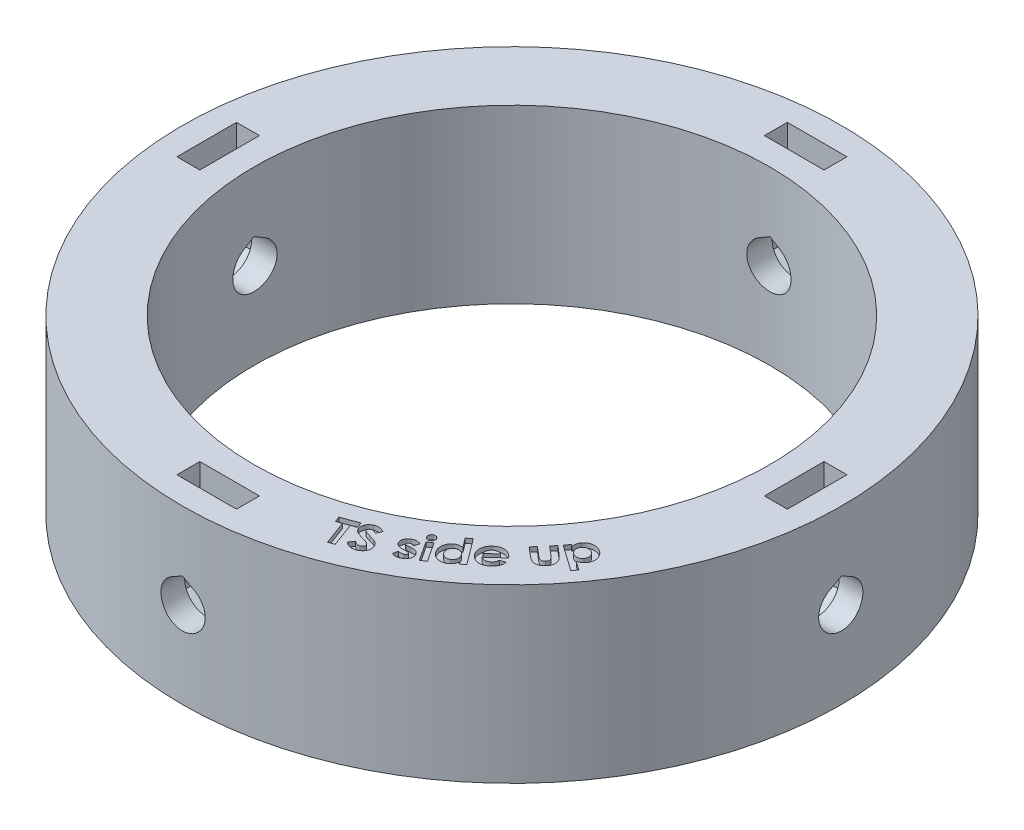
from build123d import *

# Parameters (mm, degrees)
SKETCH1_R           = 36.5125
SKETCH1_R_2         = 28.575
BOSS_EXTRUDE1_DEPTH = 19.05
CUT_EXTRUDE1_DEPTH  = 5.08
CUT_EXTRUDE2_DEPTH  = 1.27
CIRPATTERN1_COUNT   = 4
CUT_EXTRUDE3_DEPTH  = 0.5


with BuildPart() as part:
    # Sketch1 → Boss-Extrude1 (new body)
    with BuildSketch(Plane(origin=(0, 0, 0), x_dir=(1, 0, 0), z_dir=(0, 1, 0))):
        Circle(SKETCH1_R)
        Circle(SKETCH1_R_2, mode=Mode.SUBTRACT)
    extrude(amount=BOSS_EXTRUDE1_DEPTH)

    # Sketch3 → Cut-Extrude1 (cut, symmetric)
    with BuildSketch(Plane.XY.offset(-32.54375)):
        with BuildLine():
            Line((1.22555, 11.647714867), (0, 12.35528649))
            Line((0, 12.35528649), (-1.22555, 11.647714867))
            ThreePointArc((-1.22555, 11.647714867), (0, 7.0739), (1.22555, 11.647714867))
        make_face()
    cut_extrude1 = extrude(amount=CUT_EXTRUDE1_DEPTH, both=True, mode=Mode.SUBTRACT)

    # Sketch4 → Cut-Extrude2 (cut, symmetric)
    with BuildSketch(Plane.XY.offset(-32.54375)):
        Polygon((-3.302, 13.997732535), (-3.302, 26.091630277), (3.302, 26.091630277), (3.302, 14.365516556), (3.302, 7.618589411), (0, 5.712178822), (-3.302, 7.618589411), align=None)
    cut_extrude2 = extrude(amount=CUT_EXTRUDE2_DEPTH, both=True, mode=Mode.SUBTRACT)

    # CirPattern1: Cut-Extrude1, Cut-Extrude2 ×4 about axis
    cirpattern1_axis = Axis((0, -8.968103439, 0), (0, 1, 0))
    add([cut_extrude1.rotate(cirpattern1_axis, i * 360 / CIRPATTERN1_COUNT) for i in range(1, CIRPATTERN1_COUNT)], mode=Mode.SUBTRACT)
    add([cut_extrude2.rotate(cirpattern1_axis, i * 360 / CIRPATTERN1_COUNT) for i in range(1, CIRPATTERN1_COUNT)], mode=Mode.SUBTRACT)

    # Sketch8 → Cut-Extrude3 (cut)
    # profile 1 of 9: a face of its own
    with BuildSketch(Plane(origin=(0, 19.05, 0), x_dir=(1, 0, 0), z_dir=(0, 1, 0))):
        Polygon((9.730953632, -28.907476397), (11.530032158, -28.242111814), (11.756494497, -28.852788897), (11.163345459, -29.072240019), (12.141410363, -31.716871429), (11.512504113, -31.949643865), (10.534439209, -29.305012455), (9.957415972, -29.51815348), align=None)
    # profile 2 of 9: a face of its own
    with BuildSketch(Plane(origin=(0, 19.05, 0), x_dir=(1, 0, 0), z_dir=(0, 1, 0))):
        with BuildLine():
            Line((13.566608387, -27.843841245), (13.298779861, -28.436289162))
            add(Edge.make_bspline(
                [(13.298779861, -28.436289162), (13.267953168, -28.418964498), (13.20875252, -28.385693616), (13.119559328, -28.345776601), (13.035044399, -28.31555556), (12.954390805, -28.296368415), (12.877915964, -28.286693083), (12.80564399, -28.287852386), (12.737556969, -28.299498623), (12.695610369, -28.315475241), (12.674781464, -28.323408553)],
                knots=[0, 0, 0, 0, 1.289568868, 2.476532605, 3.560602779, 4.5595422, 5.495543601, 6.365438165, 7.1883458, 8, 8, 8, 8], degree=3))
            add(Edge.make_bspline(
                [(12.674781464, -28.323408553), (12.656161934, -28.332589463), (12.620306449, -28.350269072), (12.574416168, -28.38629893), (12.535651652, -28.426262918), (12.509528624, -28.47268123), (12.49042975, -28.519288897), (12.482737014, -28.565396194), (12.483851597, -28.609892049), (12.493826541, -28.636743561), (12.498799894, -28.650131309)],
                knots=[0, 0, 0, 0, 1.212126278, 2.334182229, 3.399141513, 4.448070807, 5.431410415, 6.333424315, 7.169071174, 8, 8, 8, 8], degree=3))
            add(Edge.make_bspline(
                [(12.498799894, -28.650131309), (12.505289568, -28.66309891), (12.51834332, -28.689182782), (12.547665294, -28.722260428), (12.580392583, -28.753828618), (12.607075637, -28.769154399), (12.620795086, -28.777034354)],
                knots=[0, 0, 0, 0, 0.967578232, 1.946249439, 2.944036637, 4, 4, 4, 4], degree=3))
            add(Edge.make_bspline(
                [(12.620795086, -28.777034354), (12.632427944, -28.782756936), (12.659291583, -28.795972035), (12.706565681, -28.815421072), (12.766208775, -28.836690898), (12.837917506, -28.861376108), (12.921907959, -28.888474511), (13.017985323, -28.918552871), (13.12604822, -28.951772844), (13.202453619, -28.973713285), (13.242690118, -28.985267527)],
                knots=[0, 0, 0, 0, 0.473883718, 1.094334745, 1.867397041, 2.788800434, 3.866912218, 5.093791661, 6.469536855, 8, 8, 8, 8], degree=3))
            add(Edge.make_bspline(
                [(13.242690118, -28.985267527), (13.280105289, -28.995707111), (13.351503266, -29.015628579), (13.452338206, -29.045054391), (13.542094877, -29.071181778), (13.620252774, -29.093991844), (13.687235548, -29.114628581), (13.742791483, -29.131643739), (13.786910063, -29.14656932), (13.812248587, -29.155835178), (13.823218964, -29.159846854)],
                knots=[0, 0, 0, 0, 1.537551974, 2.934053119, 4.157747224, 5.237873122, 6.15673285, 6.932090053, 7.537645724, 8, 8, 8, 8], degree=3))
            add(Edge.make_bspline(
                [(13.823218964, -29.159846854), (13.86532497, -29.177237787), (13.946088378, -29.210595285), (14.057783802, -29.268097003), (14.155644952, -29.328921232), (14.239857471, -29.39521197), (14.313548926, -29.467295753), (14.378357625, -29.546919705), (14.434931828, -29.635338601), (14.465840097, -29.698905647), (14.481572329, -29.731261117)],
                knots=[0, 0, 0, 0, 1.21847358, 2.337150645, 3.357250616, 4.296736933, 5.198789524, 6.109963901, 7.037976296, 8, 8, 8, 8], degree=3))
            add(Edge.make_bspline(
                [(14.481572329, -29.731261117), (14.495115382, -29.763261961), (14.521756954, -29.826213258), (14.549292731, -29.923503015), (14.568092231, -30.01986573), (14.575920663, -30.116052633), (14.572873958, -30.211686213), (14.560408938, -30.306931318), (14.536865819, -30.401599871), (14.503290384, -30.494734803), (14.460919589, -30.585263622), (14.408365385, -30.670397625), (14.348238575, -30.750608852), (14.278810972, -30.824771915), (14.200633472, -30.89287042), (14.11369647, -30.955141232), (14.019085999, -31.013494828), (13.950705765, -31.045590879), (13.915767041, -31.061990284)],
                knots=[0, 0, 0, 0, 1.027232463, 2.020747246, 2.984978895, 3.928457938, 4.869272605, 5.811027007, 6.765289594, 7.749520796, 8.736226468, 9.716978048, 10.704410326, 11.697564098, 12.716876414, 13.766691654, 14.8588962, 16, 16, 16, 16], degree=3))
            add(Edge.make_bspline(
                [(13.915767041, -31.061990284), (13.887842182, -31.073740279), (13.832801147, -31.096899997), (13.749195297, -31.126056355), (13.665637599, -31.147590863), (13.582498963, -31.163265045), (13.49975818, -31.172365728), (13.417256172, -31.175236445), (13.335217575, -31.17169614), (13.253350806, -31.161953938), (13.171725291, -31.145046904), (13.090155671, -31.12068912), (13.007608441, -31.090793453), (12.925294259, -31.052460453), (12.841861977, -31.008300327), (12.758943903, -30.95609588), (12.674953776, -30.897882392), (12.620562537, -30.85476899), (12.592750214, -30.832723457)],
                knots=[0, 0, 0, 0, 1.020228465, 2.010911841, 2.97882075, 3.92360299, 4.858000336, 5.779445279, 6.701192725, 7.620854235, 8.553227171, 9.504674393, 10.485806367, 11.507218269, 12.56008027, 13.66305977, 14.805032993, 16, 16, 16, 16], degree=3))
            Line((12.592750214, -30.832723457), (12.959436913, -30.301273136))
            add(Edge.make_bspline(
                [(12.959436913, -30.301273136), (12.993170003, -30.325920026), (13.057630327, -30.373017593), (13.156324285, -30.43161739), (13.251094948, -30.476844564), (13.343116445, -30.506584964), (13.431254417, -30.523506863), (13.516077971, -30.526061528), (13.59729079, -30.513768), (13.647506598, -30.494532449), (13.672477778, -30.484967046)],
                knots=[0, 0, 0, 0, 1.296238337, 2.476972667, 3.557752419, 4.548862222, 5.470922787, 6.334506283, 7.171787833, 8, 8, 8, 8], degree=3))
            add(Edge.make_bspline(
                [(13.672477778, -30.484967046), (13.696775504, -30.472650624), (13.743837613, -30.448795024), (13.805484689, -30.400914703), (13.855408957, -30.343970201), (13.892642067, -30.279673956), (13.918366194, -30.212895209), (13.928359053, -30.146246715), (13.925176911, -30.081578477), (13.91051573, -30.042079373), (13.903146849, -30.022226662)],
                knots=[0, 0, 0, 0, 1.141901761, 2.211742185, 3.254920696, 4.301785362, 5.317128285, 6.240057363, 7.115432263, 8, 8, 8, 8], degree=3))
            add(Edge.make_bspline(
                [(13.903146849, -30.022226662), (13.893900991, -30.004802902), (13.875138839, -29.969445747), (13.835319296, -29.921802647), (13.785714239, -29.879032416), (13.736310411, -29.847448728), (13.689250512, -29.823883875), (13.64616754, -29.804224217), (13.595086917, -29.784930204), (13.536696922, -29.763781172), (13.47068256, -29.741341355), (13.39674805, -29.719423783), (13.315874675, -29.695034888), (13.259092624, -29.679695504), (13.229368804, -29.671665764)],
                knots=[0, 0, 0, 0, 0.905539591, 1.837565657, 2.835889137, 3.909590732, 4.525094454, 5.256552023, 6.087180603, 7.03610872, 8.113947701, 9.294181276, 10.583579318, 12, 12, 12, 12], degree=3))
            add(Edge.make_bspline(
                [(13.229368804, -29.671665764), (13.172999458, -29.656170775), (13.064718071, -29.626406035), (12.90963149, -29.580971506), (12.768791358, -29.536404933), (12.642100467, -29.49212261), (12.529552209, -29.449039763), (12.430764385, -29.406907364), (12.345839449, -29.366280098), (12.273923597, -29.324583824), (12.211617065, -29.282306329), (12.155347723, -29.238562222), (12.103311624, -29.193430165), (12.056810297, -29.145230634), (12.014913841, -29.095389997), (11.976316354, -29.044352251), (11.944155744, -28.989923643), (11.925955943, -28.952213263), (11.916868804, -28.933384514)],
                knots=[0, 0, 0, 0, 1.803057786, 3.463541974, 4.984061263, 6.358711616, 7.602308174, 8.700227831, 9.670580559, 10.503867933, 11.261586112, 11.99114668, 12.701108216, 13.384177469, 14.054229565, 14.708748023, 15.355279378, 16, 16, 16, 16], degree=3))
            add(Edge.make_bspline(
                [(11.916868804, -28.933384514), (11.905515421, -28.906019855), (11.883178131, -28.852181072), (11.860403994, -28.768563518), (11.844939442, -28.684627883), (11.840392855, -28.599886963), (11.844619073, -28.514589032), (11.85814073, -28.42885492), (11.880637434, -28.342411695), (11.912421042, -28.256751096), (11.950895176, -28.172965307), (11.998129692, -28.094559634), (12.051900888, -28.021357952), (12.112846677, -27.954277778), (12.180719614, -27.892763908), (12.255483511, -27.837323694), (12.337032041, -27.787083939), (12.395456305, -27.759180248), (12.425182105, -27.744983072)],
                knots=[0, 0, 0, 0, 0.987500942, 1.942865397, 2.885061945, 3.830093336, 4.766918987, 5.729636897, 6.720610151, 7.74182716, 8.774352229, 9.79196116, 10.790025548, 11.800199137, 12.810372725, 13.841159362, 14.901599079, 16, 16, 16, 16], degree=3))
            add(Edge.make_bspline(
                [(12.425182105, -27.744983072), (12.464805461, -27.728808984), (12.543512747, -27.696681001), (12.667540802, -27.665964885), (12.794668129, -27.650597602), (12.903041865, -27.650148165), (12.99270784, -27.657276102), (13.064037335, -27.668958599), (13.139265015, -27.684920407), (13.217730792, -27.707068411), (13.299837149, -27.733705685), (13.385529423, -27.765627012), (13.475354764, -27.801725116), (13.53564238, -27.829549557), (13.566608387, -27.843841245)],
                knots=[0, 0, 0, 0, 1.297366174, 2.577070194, 3.863105782, 5.1751206, 5.858299831, 6.590515924, 7.366678719, 8.190831942, 9.063247061, 9.985435406, 10.965243179, 12, 12, 12, 12], degree=3))
        make_face()
    # profile 3 of 9: a face of its own
    with BuildSketch(Plane(origin=(0, 19.05, 0), x_dir=(1, 0, 0), z_dir=(0, 1, 0))):
        with BuildLine():
            Line((16.781191217, -26.958667441), (16.638162371, -27.505542441))
            add(Edge.make_bspline(
                [(16.638162371, -27.505542441), (16.611354883, -27.499133446), (16.559652719, -27.486772762), (16.48399234, -27.474301053), (16.413517132, -27.466672032), (16.347808558, -27.46604958), (16.286945904, -27.470600137), (16.231204798, -27.481063271), (16.180151766, -27.496846206), (16.149738108, -27.513006747), (16.134756922, -27.520967121)],
                knots=[0, 0, 0, 0, 1.282121409, 2.472758748, 3.565624503, 4.577004091, 5.526136088, 6.400563937, 7.212148408, 8, 8, 8, 8], degree=3))
            add(Edge.make_bspline(
                [(16.134756922, -27.520967121), (16.120200209, -27.529894209), (16.092352348, -27.546972262), (16.057308847, -27.577954075), (16.029499464, -27.610745835), (16.01072932, -27.645497281), (15.999806006, -27.680563021), (15.996537287, -27.714617226), (16.002235545, -27.747581884), (16.01201162, -27.767020474), (16.016968461, -27.776876576)],
                knots=[0, 0, 0, 0, 1.30211121, 2.491016384, 3.556082204, 4.570426685, 5.485169084, 6.344965124, 7.160834569, 8, 8, 8, 8], degree=3))
            add(Edge.make_bspline(
                [(16.016968461, -27.776876576), (16.027329, -27.790419171), (16.048849839, -27.818549757), (16.092551954, -27.840241598), (16.138635616, -27.848380076), (16.188472125, -27.851346686), (16.252369125, -27.850107097), (16.299530381, -27.84719031), (16.32546205, -27.845586512)],
                knots=[0, 0, 0, 0, 0.913761353, 1.898058716, 2.542946586, 3.443128177, 4.594101208, 6, 6, 6, 6], degree=3))
            Line((16.32546205, -27.845586512), (16.589083845, -27.827357345))
            add(Edge.make_bspline(
                [(16.589083845, -27.827357345), (16.622725188, -27.825177698), (16.687860188, -27.820957553), (16.782598447, -27.81989231), (16.871050628, -27.821484776), (16.95316273, -27.827977032), (17.02933889, -27.837407273), (17.099120451, -27.851393283), (17.163054812, -27.868712744), (17.239030051, -27.897630242), (17.326486067, -27.943475915), (17.418948832, -28.016553913), (17.502041749, -28.10425836), (17.546021072, -28.172901613), (17.568550993, -28.20806648)],
                knots=[0, 0, 0, 0, 1.084942734, 2.100621962, 3.048753861, 3.931512788, 4.750764755, 5.51793512, 6.220615562, 6.88008866, 8.13196131, 9.380937463, 10.658295171, 12, 12, 12, 12], degree=3))
            add(Edge.make_bspline(
                [(17.568550993, -28.20806648), (17.582158104, -28.232581577), (17.609001826, -28.280944264), (17.639651722, -28.356725005), (17.661761986, -28.433331223), (17.675166695, -28.510926896), (17.679982205, -28.589665843), (17.676667584, -28.669406799), (17.66355666, -28.749677795), (17.642769956, -28.830093938), (17.613074452, -28.909088591), (17.576385187, -28.986065188), (17.529288035, -29.058307049), (17.474953946, -29.127627594), (17.412299808, -29.193326716), (17.341975701, -29.256351429), (17.262202445, -29.314255695), (17.205134357, -29.349619949), (17.175922788, -29.367721928)],
                knots=[0, 0, 0, 0, 0.978962257, 1.931268867, 2.848804707, 3.760361627, 4.676733912, 5.600390469, 6.542842938, 7.513356419, 8.497786738, 9.487520174, 10.486474668, 11.504210383, 12.561284597, 13.654456509, 14.799381432, 16, 16, 16, 16], degree=3))
            add(Edge.make_bspline(
                [(17.175922788, -29.367721928), (17.13566546, -29.389578053), (17.056941997, -29.432317845), (16.933936547, -29.481437411), (16.809717655, -29.513511691), (16.684602874, -29.531905437), (16.558572733, -29.532671703), (16.43168238, -29.519481525), (16.304154977, -29.489815971), (16.221166169, -29.459084427), (16.178927595, -29.443443082)],
                knots=[0, 0, 0, 0, 1.058071475, 2.06906555, 3.051597455, 4.01708743, 4.983951211, 5.956185788, 6.959765787, 8, 8, 8, 8], degree=3))
            Line((16.178927595, -29.443443082), (16.301623909, -28.869925454))
            add(Edge.make_bspline(
                [(16.301623909, -28.869925454), (16.329281438, -28.878691582), (16.384182654, -28.896092671), (16.468908858, -28.911732333), (16.554044598, -28.92031544), (16.638541132, -28.921043327), (16.719057034, -28.914258282), (16.792334778, -28.901125658), (16.857508456, -28.88237501), (16.895494125, -28.862585153), (16.913703236, -28.853098531)],
                knots=[0, 0, 0, 0, 1.107694917, 2.198815272, 3.28466059, 4.374171838, 5.422805234, 6.366909422, 7.217148777, 8, 8, 8, 8], degree=3))
            add(Edge.make_bspline(
                [(16.913703236, -28.853098531), (16.930885894, -28.842138184), (16.963848324, -28.821112352), (17.005640972, -28.783040551), (17.0380211, -28.741482916), (17.061407026, -28.697606358), (17.074418369, -28.652919475), (17.079730611, -28.610206661), (17.07319712, -28.569728692), (17.06177781, -28.54601979), (17.056030961, -28.534088114)],
                knots=[0, 0, 0, 0, 1.264821735, 2.426376532, 3.492495375, 4.525354141, 5.494910021, 6.370626384, 7.180005983, 8, 8, 8, 8], degree=3))
            add(Edge.make_bspline(
                [(17.056030961, -28.534088114), (17.048984269, -28.523896625), (17.034453311, -28.502880793), (17.003130183, -28.477526616), (16.964559016, -28.457497855), (16.919080751, -28.441232857), (16.866227891, -28.430432489), (16.806114863, -28.424578384), (16.738633051, -28.422310109), (16.691207456, -28.424801848), (16.666207243, -28.426115358)],
                knots=[0, 0, 0, 0, 0.699974392, 1.44341468, 2.255976412, 3.157530186, 4.174156525, 5.307275732, 6.580541183, 8, 8, 8, 8], degree=3))
            Line((16.666207243, -28.426115358), (16.424320223, -28.442241159))
            add(Edge.make_bspline(
                [(16.424320223, -28.442241159), (16.36847132, -28.444666474), (16.261591877, -28.449307861), (16.107859182, -28.43982279), (15.968274542, -28.415578463), (15.842790793, -28.377281467), (15.730696212, -28.325628528), (15.633843052, -28.257854604), (15.550812162, -28.175908366), (15.508286626, -28.1114474), (15.486920384, -28.079060069)],
                knots=[0, 0, 0, 0, 1.264049976, 2.419044032, 3.476942588, 4.46197514, 5.379658928, 6.256784226, 7.124150475, 8, 8, 8, 8], degree=3))
            add(Edge.make_bspline(
                [(15.486920384, -28.079060069), (15.475076619, -28.057053891), (15.451751739, -28.01371535), (15.423843227, -27.945858666), (15.405105902, -27.876294173), (15.393967129, -27.805542542), (15.389321783, -27.733643507), (15.393976784, -27.660310267), (15.405975006, -27.585646653), (15.425680161, -27.510619144), (15.451767522, -27.436287752), (15.48669907, -27.365539887), (15.527129325, -27.297753059), (15.575441861, -27.234391796), (15.630117439, -27.174500929), (15.692423227, -27.119349064), (15.760655328, -27.066621865), (15.810528712, -27.036035613), (15.836079038, -27.020366159)],
                knots=[0, 0, 0, 0, 0.964468801, 1.899406238, 2.825287424, 3.739043083, 4.660959021, 5.600890006, 6.569528091, 7.576206753, 8.592223112, 9.605109678, 10.617111733, 11.634889369, 12.67580082, 13.742820204, 14.84363813, 16, 16, 16, 16], degree=3))
            add(Edge.make_bspline(
                [(15.836079038, -27.020366159), (15.872357555, -27.000788065), (15.944275677, -26.961976675), (16.058926009, -26.919548344), (16.176844131, -26.889443704), (16.298107018, -26.874410212), (16.420729736, -26.872602877), (16.542733707, -26.886537018), (16.664140408, -26.913180367), (16.741794604, -26.943357537), (16.781191217, -26.958667441)],
                knots=[0, 0, 0, 0, 1.006208345, 1.994695994, 2.978024038, 3.973873601, 4.973253281, 5.967087036, 6.968634164, 8, 8, 8, 8], degree=3))
        make_face()
    # profile 4 of 9: a face of its own
    with BuildSketch(Plane(origin=(0, 19.05, 0), x_dir=(1, 0, 0), z_dir=(0, 1, 0))):
        with BuildLine():
            add(Edge.make_bspline(
                [(16.622449765, -25.390707394), (16.646270252, -25.376823256), (16.692897494, -25.349645851), (16.770779977, -25.326767194), (16.851711329, -25.32161132), (16.933588762, -25.331650603), (17.013031041, -25.355242434), (17.084807173, -25.395057991), (17.148210665, -25.448258875), (17.180735351, -25.49321568), (17.197369637, -25.516208195)],
                knots=[0, 0, 0, 0, 1.0093759, 1.975795618, 2.947721828, 3.967220221, 4.990358339, 5.969528258, 6.961544217, 8, 8, 8, 8], degree=3))
            add(Edge.make_bspline(
                [(17.197369637, -25.516208195), (17.211570195, -25.540238079), (17.23921248, -25.587013766), (17.261609498, -25.665548931), (17.26896006, -25.746298627), (17.258986914, -25.827897135), (17.237129702, -25.906686587), (17.198964757, -25.977206632), (17.148368855, -26.038948798), (17.105599018, -26.070255101), (17.083787906, -26.086220214)],
                knots=[0, 0, 0, 0, 1.034983688, 2.014661176, 3.009965468, 4.033816618, 5.057667767, 6.034329309, 6.997577105, 8, 8, 8, 8], degree=3))
            add(Edge.make_bspline(
                [(17.083787906, -26.086220214), (17.059765553, -26.100438474), (17.012617136, -26.128344501), (16.933485683, -26.150449945), (16.85175316, -26.157134856), (16.769140258, -26.146162474), (16.689612488, -26.120660408), (16.617217093, -26.080495075), (16.553121278, -26.026738679), (16.520564816, -25.981160812), (16.503960182, -25.957914926)],
                knots=[0, 0, 0, 0, 1.010557539, 1.98341048, 2.954519855, 3.973073982, 4.99088442, 5.971600194, 6.965463858, 8, 8, 8, 8], degree=3))
            add(Edge.make_bspline(
                [(16.503960182, -25.957914926), (16.490043763, -25.934339629), (16.4627024, -25.888021627), (16.440299747, -25.810451098), (16.434147703, -25.730408831), (16.443162452, -25.649399602), (16.467831549, -25.571653543), (16.504664492, -25.499977842), (16.557532177, -25.43892628), (16.600521272, -25.406995237), (16.622449765, -25.390707394)],
                knots=[0, 0, 0, 0, 1.017870471, 1.999793523, 2.979275759, 3.996810219, 5.019707609, 6.00630164, 6.983025805, 8, 8, 8, 8], degree=3))
        make_face()
    # profile 5 of 9: a face of its own
    with BuildSketch(Plane(origin=(0, 19.05, 0), x_dir=(1, 0, 0), z_dir=(0, 1, 0))):
        Polygon((16.930242233, -26.450803548), (17.470106015, -26.097438163), (18.87445297, -28.242870855), (18.334589188, -28.59623624), align=None)
    # profile 6 of 9: a face of its own
    with BuildSketch(Plane(origin=(0, 19.05, 0), x_dir=(1, 0, 0), z_dir=(0, 1, 0))):
        with BuildLine():
            Line((18.738323734, -23.921509229), (19.250843766, -23.537294485))
            Line((19.250843766, -23.537294485), (21.385058509, -26.37894112))
            Line((21.385058509, -26.37894112), (20.872538477, -26.763155863))
            Line((20.872538477, -26.763155863), (20.709878221, -26.546509229))
            add(Edge.make_bspline(
                [(20.709878221, -26.546509229), (20.70223054, -26.587818492), (20.687389947, -26.667980559), (20.653249183, -26.781578883), (20.612694205, -26.885726944), (20.564174671, -26.980650751), (20.506408527, -27.067381026), (20.439832693, -27.14760203), (20.364916905, -27.223288641), (20.308625609, -27.267823798), (20.280090561, -27.290399453)],
                knots=[0, 0, 0, 0, 1.142010487, 2.216111178, 3.220709643, 4.178857738, 5.109794492, 6.049093607, 7.011051201, 8, 8, 8, 8], degree=3))
            add(Edge.make_bspline(
                [(20.280090561, -27.290399453), (20.246692961, -27.314078425), (20.180854099, -27.360758325), (20.074604039, -27.416646881), (19.965284906, -27.4614543), (19.851690595, -27.493716588), (19.734214772, -27.514282891), (19.612703693, -27.521583487), (19.48752913, -27.517503751), (19.360231158, -27.500176192), (19.233444023, -27.473041505), (19.110995458, -27.432617258), (18.993798083, -27.381451421), (18.882700755, -27.317816835), (18.777027106, -27.243174381), (18.677051127, -27.156801657), (18.58191363, -27.059640284), (18.525216427, -26.987151141), (18.496436714, -26.950355382)],
                knots=[0, 0, 0, 0, 0.971843244, 1.91585789, 2.844957526, 3.774770457, 4.716004494, 5.673076446, 6.662076694, 7.686982627, 8.721754666, 9.73850472, 10.745503012, 11.755238236, 12.775182888, 13.814771302, 14.89076976, 16, 16, 16, 16], degree=3))
            add(Edge.make_bspline(
                [(18.496436714, -26.950355382), (18.468174159, -26.911078422), (18.412739224, -26.834039539), (18.342688064, -26.712781351), (18.284661885, -26.590796601), (18.240193842, -26.467234511), (18.208351235, -26.342575329), (18.189384336, -26.216446951), (18.182814431, -26.089124366), (18.190175702, -25.961848347), (18.208943696, -25.837505479), (18.238033305, -25.718222993), (18.279175693, -25.60606022), (18.330462416, -25.50011673), (18.393051236, -25.400692596), (18.467536571, -25.308683326), (18.551542245, -25.222267293), (18.615037621, -25.171876145), (18.6471779, -25.146369004)],
                knots=[0, 0, 0, 0, 1.148151085, 2.252014308, 3.319240039, 4.351183292, 5.364463099, 6.3688329, 7.374305462, 8.385608669, 9.389978471, 10.356153547, 11.29518435, 12.220743601, 13.145853749, 14.077330778, 15.026777555, 16, 16, 16, 16], degree=3))
            add(Edge.make_bspline(
                [(18.6471779, -25.146369004), (18.678068078, -25.124435725), (18.739337355, -25.080932054), (18.837836217, -25.027980183), (18.939731095, -24.985401378), (19.045403131, -24.953524075), (19.155019032, -24.933569787), (19.268141078, -24.923561924), (19.384651628, -24.924907649), (19.462873893, -24.934149627), (19.50254649, -24.938836953)],
                knots=[0, 0, 0, 0, 1.00449744, 1.992375475, 2.959798334, 3.930970562, 4.914967476, 5.910987181, 6.940499039, 8, 8, 8, 8], degree=3))
            Line((19.50254649, -24.938836953), (18.738323734, -23.921509229))
        make_face()
        with BuildLine():
            add(Edge.make_bspline(
                [(19.108516041, -25.541801696), (19.089196969, -25.556782888), (19.05118114, -25.586262689), (19.001700939, -25.637415069), (18.957861068, -25.690754082), (18.920141346, -25.747409645), (18.889160328, -25.807798194), (18.865507138, -25.87195023), (18.847823525, -25.939089664), (18.836678153, -26.008830139), (18.832504384, -26.079999944), (18.83536504, -26.151141182), (18.844900119, -26.221506397), (18.863035156, -26.290865864), (18.88755007, -26.359665524), (18.919236223, -26.427712709), (18.958109839, -26.495122615), (18.988934226, -26.537887938), (19.004750016, -26.559830543)],
                knots=[0, 0, 0, 0, 1.022658212, 2.012374035, 2.972363332, 3.91162174, 4.857131944, 5.807946524, 6.769431521, 7.760646511, 8.760713529, 9.750042101, 10.738353418, 11.728262809, 12.746790948, 13.793384246, 14.867800026, 16, 16, 16, 16], degree=3))
            add(Edge.make_bspline(
                [(19.004750016, -26.559830543), (19.021430777, -26.581189721), (19.054094526, -26.623014601), (19.108706803, -26.679170556), (19.165320253, -26.729380299), (19.225435678, -26.772240599), (19.28802973, -26.809259647), (19.354009233, -26.8385343), (19.422643265, -26.861067008), (19.493051087, -26.877195765), (19.564202206, -26.88614622), (19.634702304, -26.888722532), (19.703454276, -26.882578796), (19.77066011, -26.871264301), (19.835446236, -26.850843533), (19.899143641, -26.825066023), (19.960987096, -26.791364798), (19.999675469, -26.763798428), (20.019273253, -26.749834549)],
                knots=[0, 0, 0, 0, 1.126902004, 2.206664504, 3.254108338, 4.271509047, 5.273880717, 6.275072431, 7.268346088, 8.275658477, 9.275574275, 10.248455134, 11.204619677, 12.143115688, 13.078280645, 14.024553479, 14.999327907, 16, 16, 16, 16], degree=3))
            add(Edge.make_bspline(
                [(20.019273253, -26.749834549), (20.038717491, -26.734269149), (20.076876936, -26.703721949), (20.128416995, -26.653066716), (20.172919267, -26.598650214), (20.210754159, -26.540972652), (20.242880179, -26.48039967), (20.267232012, -26.415996104), (20.285805068, -26.34844029), (20.296439173, -26.277848849), (20.301786213, -26.206072615), (20.298938572, -26.134106326), (20.288143228, -26.062998798), (20.270607486, -25.992224372), (20.245053671, -25.922177973), (20.212706315, -25.852377341), (20.17245249, -25.783204928), (20.140713931, -25.739029722), (20.124441522, -25.716381023)],
                knots=[0, 0, 0, 0, 1.025770081, 2.013080445, 2.971077312, 3.916506227, 4.851134396, 5.789969389, 6.747675851, 7.732353133, 8.726448894, 9.70938259, 10.692599239, 11.685154815, 12.708572001, 13.759744121, 14.851417243, 16, 16, 16, 16], degree=3))
            add(Edge.make_bspline(
                [(20.124441522, -25.716381023), (20.107526088, -25.694788934), (20.074597192, -25.6527561), (20.019794401, -25.596327625), (19.96315442, -25.546155223), (19.903365758, -25.50337079), (19.841288587, -25.467136596), (19.776396946, -25.43825207), (19.708706607, -25.416390246), (19.638876082, -25.401877649), (19.568655682, -25.394156224), (19.498914421, -25.393463542), (19.43041664, -25.399393262), (19.363097606, -25.413982427), (19.297165267, -25.434720483), (19.232735762, -25.46369184), (19.168657542, -25.498003065), (19.128767673, -25.527053249), (19.108516041, -25.541801696)],
                knots=[0, 0, 0, 0, 1.137197933, 2.213757636, 3.258094537, 4.272477426, 5.258619391, 6.235182286, 7.213284136, 8.203991157, 9.18903627, 10.139253449, 11.093419599, 12.03469102, 12.991366131, 13.955138881, 14.961847336, 16, 16, 16, 16], degree=3))
        make_face(mode=Mode.SUBTRACT)
    # profile 7 of 9: a face of its own
    with BuildSketch(Plane(origin=(0, 19.05, 0), x_dir=(1, 0, 0), z_dir=(0, 1, 0))):
        with BuildLine():
            Line((23.057973735, -23.41821344), (21.521114761, -24.811342446))
            add(Edge.make_bspline(
                [(21.521114761, -24.811342446), (21.539089548, -24.825259572), (21.574412752, -24.85260885), (21.631051173, -24.886875969), (21.688503297, -24.91571475), (21.746906708, -24.93896626), (21.806450564, -24.956853026), (21.867295347, -24.9685335), (21.929236604, -24.975181362), (21.991921754, -24.974795293), (22.05465403, -24.969568334), (22.117099556, -24.957335659), (22.178535566, -24.93908914), (22.23905307, -24.915131758), (22.298463702, -24.88544025), (22.356772959, -24.849415184), (22.414313194, -24.807283453), (22.451014475, -24.775612157), (22.469732549, -24.759459433)],
                knots=[0, 0, 0, 0, 1.044695683, 2.052986632, 3.038332538, 3.998322903, 4.940274833, 5.89301806, 6.84375864, 7.80031346, 8.771430011, 9.734723759, 10.720948523, 11.714873728, 12.724252462, 13.771267608, 14.863320959, 16, 16, 16, 16], degree=3))
            add(Edge.make_bspline(
                [(22.469732549, -24.759459433), (22.491209599, -24.739084062), (22.533651533, -24.698819214), (22.588906718, -24.63170864), (22.637013663, -24.561069425), (22.677817486, -24.48703299), (22.710152038, -24.408828333), (22.735699779, -24.327540547), (22.752503824, -24.241896093), (22.757934864, -24.183434542), (22.760698094, -24.153690202)],
                knots=[0, 0, 0, 0, 1.029366084, 2.034184702, 3.017647947, 4.000303861, 4.969951071, 5.957708935, 6.960913651, 8, 8, 8, 8], degree=3))
            Line((22.760698094, -24.153690202), (23.334916844, -23.977708632))
            add(Edge.make_bspline(
                [(23.334916844, -23.977708632), (23.338035455, -24.006660042), (23.344185662, -24.063755054), (23.347874927, -24.149003693), (23.345294098, -24.23231104), (23.339614119, -24.313891181), (23.327233384, -24.393439882), (23.310754031, -24.471582787), (23.28789603, -24.547690513), (23.261520855, -24.622684761), (23.228893028, -24.69554252), (23.191679015, -24.767564454), (23.148582269, -24.838205786), (23.101131958, -24.908569009), (23.047372083, -24.977342013), (22.98861004, -25.045400481), (22.923866876, -25.111963079), (22.877964408, -25.154845121), (22.854648414, -25.176626901)],
                knots=[0, 0, 0, 0, 1.036112947, 2.043316114, 3.033341128, 4.001000387, 4.95138539, 5.895893285, 6.840694072, 7.777222294, 8.723010927, 9.679019881, 10.66034306, 11.666102995, 12.697532166, 13.764723058, 14.864599072, 16, 16, 16, 16], degree=3))
            add(Edge.make_bspline(
                [(22.854648414, -25.176626901), (22.817373448, -25.209146872), (22.744410273, -25.272802472), (22.627041494, -25.354094478), (22.507734908, -25.422898016), (22.384945416, -25.477108525), (22.259326119, -25.51817964), (22.130794249, -25.545718823), (21.999380426, -25.558856428), (21.866657025, -25.558910672), (21.735224849, -25.545443596), (21.606998995, -25.520545505), (21.484039698, -25.481548734), (21.36559854, -25.430594218), (21.2512126, -25.368484223), (21.143252029, -25.291435015), (21.038465408, -25.204097427), (20.974995338, -25.137107014), (20.94268928, -25.103009113)],
                knots=[0, 0, 0, 0, 1.106151353, 2.165214948, 3.188783591, 4.183847193, 5.162882119, 6.141386153, 7.119149251, 8.112768888, 9.106140778, 10.071235098, 11.03054538, 11.986399912, 12.953023252, 13.936684312, 14.949779053, 16, 16, 16, 16], degree=3))
            add(Edge.make_bspline(
                [(20.94268928, -25.103009113), (20.911105772, -25.066663366), (20.849096252, -24.995303899), (20.770138237, -24.880131322), (20.702565615, -24.762489784), (20.648515977, -24.641040988), (20.607471044, -24.516326696), (20.580090446, -24.388212621), (20.565225896, -24.256931662), (20.564181398, -24.123543519), (20.575057101, -23.991094469), (20.59891838, -23.86209716), (20.635499614, -23.737993133), (20.68492069, -23.618885029), (20.746898294, -23.504473917), (20.822469989, -23.395934997), (20.909867743, -23.291744755), (20.97618134, -23.22830698), (21.009996972, -23.195957831)],
                knots=[0, 0, 0, 0, 1.081926538, 2.124201845, 3.133854205, 4.1289602, 5.107767588, 6.080759849, 7.069630015, 8.073398338, 9.075390578, 10.05352061, 11.017932048, 11.979202889, 12.94801401, 13.937777414, 14.948400285, 16, 16, 16, 16], degree=3))
            add(Edge.make_bspline(
                [(21.009996972, -23.195957831), (21.047507574, -23.163436477), (21.120947236, -23.099764955), (21.239012117, -23.018462299), (21.359044326, -22.949725689), (21.482385617, -22.895317025), (21.608887395, -22.855124429), (21.738095231, -22.828307543), (21.870449263, -22.81559612), (22.00434965, -22.817345687), (22.138313361, -22.831762437), (22.26979525, -22.860473823), (22.397436699, -22.903839263), (22.52160565, -22.960157183), (22.641993637, -23.030842235), (22.758380542, -23.11542624), (22.871533376, -23.213454358), (22.94149472, -23.28718351), (22.977344728, -23.324964241)],
                knots=[0, 0, 0, 0, 1.073311277, 2.101369007, 3.09535612, 4.062015476, 5.011814752, 5.961748588, 6.911588234, 7.882390529, 8.853903523, 9.821831391, 10.787538269, 11.765005969, 12.766563816, 13.80219005, 14.873785134, 16, 16, 16, 16], degree=3))
            Line((22.977344728, -23.324964241), (23.057973735, -23.41821344))
        make_face()
        with BuildLine():
            add(Edge.make_bspline(
                [(22.236258991, -23.47710767), (22.204065051, -23.459367572), (22.140281223, -23.42422023), (22.035405791, -23.391780846), (21.925769569, -23.378767609), (21.813475236, -23.383279394), (21.701367812, -23.404216026), (21.594292186, -23.44573449), (21.49148835, -23.502113147), (21.431262971, -23.553329049), (21.400521812, -23.579471452)],
                knots=[0, 0, 0, 0, 0.974136179, 1.929994708, 2.892918007, 3.892728655, 4.904104832, 5.905704964, 6.930997908, 8, 8, 8, 8], degree=3))
            add(Edge.make_bspline(
                [(21.400521812, -23.579471452), (21.384359847, -23.594633221), (21.352490453, -23.624530353), (21.309842868, -23.673477615), (21.27086646, -23.723551523), (21.238000043, -23.776771786), (21.208971035, -23.831730761), (21.184411152, -23.888809493), (21.16539241, -23.948323166), (21.156234929, -23.988850906), (21.151623575, -24.009259113)],
                knots=[0, 0, 0, 0, 1.051487005, 2.073402244, 3.078737398, 4.0608415, 5.038610967, 6.027897255, 7.006925113, 8, 8, 8, 8], degree=3))
            add(Edge.make_bspline(
                [(21.151623575, -24.009259113), (21.147937909, -24.037260427), (21.140090385, -24.096880871), (21.14674908, -24.193797722), (21.16686806, -24.301715925), (21.188984449, -24.376361314), (21.2007021, -24.415909754)],
                knots=[0, 0, 0, 0, 0.818059681, 1.741813984, 2.803573342, 4, 4, 4, 4], degree=3))
            Line((21.2007021, -24.415909754), (22.236258991, -23.47710767))
        make_face(mode=Mode.SUBTRACT)
    # profile 8 of 9: a face of its own
    with BuildSketch(Plane(origin=(0, 19.05, 0), x_dir=(1, 0, 0), z_dir=(0, 1, 0))):
        with BuildLine():
            Line((23.12940605, -21.223085966), (23.552883614, -20.727392857))
            Line((23.552883614, -20.727392857), (24.494490184, -21.532280677))
            add(Edge.make_bspline(
                [(24.494490184, -21.532280677), (24.516565663, -21.551132392), (24.558877555, -21.587265322), (24.62183016, -21.636844559), (24.679386456, -21.682137304), (24.733851059, -21.720207356), (24.782540859, -21.754755462), (24.828167086, -21.781630522), (24.869010231, -21.804107174), (24.917756868, -21.825213587), (24.976003932, -21.842752486), (25.044681233, -21.853672699), (25.112413514, -21.853903095), (25.178827023, -21.842574198), (25.242965068, -21.81985303), (25.304419624, -21.786249236), (25.362164458, -21.740964107), (25.396162371, -21.70409929), (25.413660858, -21.685125228)],
                knots=[0, 0, 0, 0, 1.305231387, 2.501726505, 3.603202287, 4.597653467, 5.489647141, 6.286279114, 6.977422217, 7.584603099, 8.671747176, 9.703268579, 10.701654683, 11.703739855, 12.717495092, 13.747462796, 14.84063493, 16, 16, 16, 16], degree=3))
            add(Edge.make_bspline(
                [(25.413660858, -21.685125228), (25.429727835, -21.665001263), (25.460960811, -21.625881812), (25.495898615, -21.561505182), (25.520667837, -21.495994463), (25.533327525, -21.428622457), (25.534718019, -21.360155414), (25.524649942, -21.290994108), (25.502699229, -21.221663305), (25.480009708, -21.177681657), (25.468348358, -21.155077151)],
                knots=[0, 0, 0, 0, 1.079618225, 2.098695331, 3.06133789, 4.010324537, 4.962553861, 5.924445626, 6.933262349, 8, 8, 8, 8], degree=3))
            add(Edge.make_bspline(
                [(25.468348358, -21.155077151), (25.46243746, -21.145613085), (25.44946324, -21.124839782), (25.424006028, -21.093196824), (25.392613215, -21.056792285), (25.354059871, -21.016500191), (25.308912689, -20.9721011), (25.256681048, -20.923842168), (25.198243261, -20.870493149), (25.155997687, -20.834532896), (25.133913261, -20.815734203)],
                knots=[0, 0, 0, 0, 0.559813748, 1.228772149, 2.035713717, 2.973651164, 4.027454617, 5.214709003, 6.543952691, 8, 8, 8, 8], degree=3))
            Line((25.133913261, -20.815734203), (24.17618089, -19.997525068))
            Line((24.17618089, -19.997525068), (24.596853967, -19.505337568))
            Line((24.596853967, -19.505337568), (25.424878806, -20.212769459))
            add(Edge.make_bspline(
                [(25.424878806, -20.212769459), (25.465734805, -20.248078136), (25.544013307, -20.315728184), (25.653413834, -20.416282109), (25.7513636, -20.510045437), (25.83654261, -20.598133811), (25.910338619, -20.679335127), (25.970783851, -20.755322616), (26.019956057, -20.824651915), (26.045049548, -20.870891717), (26.056589543, -20.892156478)],
                knots=[0, 0, 0, 0, 1.389807981, 2.662817954, 3.82422911, 4.879244226, 5.816414055, 6.646889822, 7.37773167, 8, 8, 8, 8], degree=3))
            add(Edge.make_bspline(
                [(26.056589543, -20.892156478), (26.068178912, -20.916769975), (26.090924141, -20.965076284), (26.118301539, -21.039477479), (26.140105529, -21.113736067), (26.156238139, -21.188247332), (26.16708999, -21.262732621), (26.170997229, -21.337316677), (26.169931359, -21.41188845), (26.161808365, -21.486379799), (26.148816518, -21.561083968), (26.128316063, -21.635707442), (26.100411091, -21.709858127), (26.067843073, -21.784915432), (26.026676369, -21.858623861), (25.980087913, -21.932954638), (25.926921038, -22.007374537), (25.886999926, -22.055332579), (25.866585537, -22.079856799)],
                knots=[0, 0, 0, 0, 1.016615684, 1.9952042, 2.960085713, 3.907725833, 4.843042621, 5.770615332, 6.696870468, 7.627933935, 8.568783746, 9.52890704, 10.515690249, 11.528733241, 12.584392841, 13.667919895, 14.807448313, 16, 16, 16, 16], degree=3))
            add(Edge.make_bspline(
                [(25.866585537, -22.079856799), (25.84374117, -22.105602461), (25.799174702, -22.155828986), (25.728781384, -22.225073175), (25.656631509, -22.285999454), (25.583351803, -22.339334288), (25.509794298, -22.386625472), (25.433625082, -22.423877675), (25.357156387, -22.455627442), (25.278895583, -22.477686858), (25.200072375, -22.493105523), (25.120846454, -22.502408545), (25.041295487, -22.504553731), (24.961363551, -22.499328599), (24.880966968, -22.488158195), (24.800035843, -22.470620766), (24.718871387, -22.446042342), (24.66587565, -22.424531493), (24.638921274, -22.413590773)],
                knots=[0, 0, 0, 0, 1.201229213, 2.343446062, 3.443336091, 4.494149449, 5.505888473, 6.490930993, 7.449852577, 8.392253069, 9.323393299, 10.251311703, 11.173474627, 12.097079784, 13.044270145, 14.004336172, 14.98497738, 16, 16, 16, 16], degree=3))
            add(Edge.make_bspline(
                [(24.638921274, -22.413590773), (24.618671713, -22.404544892), (24.574720187, -22.384910874), (24.506972358, -22.346181289), (24.431300633, -22.298636045), (24.34871338, -22.240370358), (24.257729648, -22.17414404), (24.159185579, -22.098069268), (24.053753586, -22.011713708), (23.981188132, -21.95047923), (23.943408454, -21.918598786)],
                knots=[0, 0, 0, 0, 0.621293676, 1.348513441, 2.184513081, 3.125776554, 4.180482982, 5.338712105, 6.61445639, 8, 8, 8, 8], degree=3))
            Line((23.943408454, -21.918598786), (23.12940605, -21.223085966))
        make_face()
    # profile 9 of 9: a face of its own
    with BuildSketch(Plane(origin=(0, 19.05, 0), x_dir=(1, 0, 0), z_dir=(0, 1, 0))):
        with BuildLine():
            Line((25.225824961, -18.648484314), (25.457195154, -18.812546814))
            add(Edge.make_bspline(
                [(25.457195154, -18.812546814), (25.451257059, -18.772428595), (25.439630613, -18.693879442), (25.43598641, -18.576442008), (25.441745602, -18.462777863), (25.459475802, -18.352323799), (25.488404589, -18.24549894), (25.52785329, -18.141830047), (25.578272349, -18.04144909), (25.620326769, -17.978958702), (25.641590186, -17.947362519)],
                knots=[0, 0, 0, 0, 1.069943435, 2.094887438, 3.096022652, 4.070876562, 5.042287544, 6.012914341, 6.995296342, 8, 8, 8, 8], degree=3))
            add(Edge.make_bspline(
                [(25.641590186, -17.947362519), (25.66639229, -17.914320428), (25.715127157, -17.849394411), (25.799146063, -17.762464433), (25.88943818, -17.685928178), (25.986989197, -17.619812194), (26.09205272, -17.566095996), (26.203568258, -17.522241156), (26.322016033, -17.489433066), (26.445919103, -17.467125147), (26.573167069, -17.456621835), (26.700980907, -17.458467884), (26.827818635, -17.474163076), (26.953569973, -17.502668684), (27.078696537, -17.543159306), (27.202408484, -17.598075444), (27.325971668, -17.664468461), (27.404667676, -17.718058795), (27.444875442, -17.745439442)],
                knots=[0, 0, 0, 0, 0.977935556, 1.921593309, 2.856587706, 3.777893969, 4.706440958, 5.646111419, 6.611920764, 7.613178801, 8.624200387, 9.631942483, 10.635890764, 11.645926587, 12.682382039, 13.745941132, 14.848344716, 16, 16, 16, 16], degree=3))
            add(Edge.make_bspline(
                [(27.444875442, -17.745439442), (27.4825757, -17.773280394), (27.55675741, -17.828062231), (27.657204139, -17.92063794), (27.746474113, -18.01865577), (27.824286075, -18.122751655), (27.891412275, -18.232276937), (27.946250917, -18.348464533), (27.988847686, -18.470610575), (28.020966379, -18.596555753), (28.041299579, -18.723771139), (28.049022865, -18.849147663), (28.045247141, -18.970865157), (28.028258775, -19.089130117), (27.998602913, -19.203776669), (27.957033355, -19.314904717), (27.90359275, -19.42283211), (27.858831317, -19.490051395), (27.836101404, -19.524185435)],
                knots=[0, 0, 0, 0, 1.109544033, 2.183217754, 3.229698127, 4.246165847, 5.257373125, 6.267792008, 7.28336979, 8.317297601, 9.343085469, 10.330429163, 11.288787219, 12.222850394, 13.1547453, 14.088480273, 15.029327807, 16, 16, 16, 16], degree=3))
            add(Edge.make_bspline(
                [(27.836101404, -19.524185435), (27.814239332, -19.553406641), (27.771166521, -19.610978471), (27.697324119, -19.688208839), (27.618738413, -19.757630382), (27.532931357, -19.817850378), (27.439011082, -19.869444837), (27.336018186, -19.91372359), (27.222841098, -19.950267639), (27.143101898, -19.967521326), (27.102026884, -19.976408993)],
                knots=[0, 0, 0, 0, 0.988396787, 1.94734652, 2.890090337, 3.826813172, 4.782346345, 5.789644213, 6.861408257, 8, 8, 8, 8], degree=3))
            Line((27.102026884, -19.976408993), (28.090608615, -20.676128544))
            Line((28.090608615, -20.676128544), (27.721117429, -21.198464282))
            Line((27.721117429, -21.198464282), (24.856333775, -19.170820051))
            Line((24.856333775, -19.170820051), (25.225824961, -18.648484314))
        make_face()
        with BuildLine():
            add(Edge.make_bspline(
                [(26.04964307, -18.40098832), (26.035623825, -18.421744798), (26.0081941, -18.462356433), (25.975595843, -18.526960324), (25.948208073, -18.591522826), (25.92911143, -18.65790675), (25.918308453, -18.725711238), (25.912884485, -18.794483027), (25.916093933, -18.864281339), (25.925848852, -18.934253293), (25.942471191, -19.003404612), (25.966589657, -19.070565189), (25.997434886, -19.134879915), (26.034818852, -19.196746492), (26.080122997, -19.254734773), (26.131555416, -19.310215024), (26.189274589, -19.363579423), (26.232302388, -19.395125411), (26.254370634, -19.411304826)],
                knots=[0, 0, 0, 0, 1.038516177, 2.031936229, 2.997404879, 3.946014805, 4.890001824, 5.842965464, 6.803990215, 7.783390195, 8.771445116, 9.750124402, 10.7392737, 11.727376228, 12.743964765, 13.78727113, 14.865127947, 16, 16, 16, 16], degree=3))
            add(Edge.make_bspline(
                [(26.254370634, -19.411304826), (26.277521878, -19.426843694), (26.322826352, -19.457251573), (26.393227231, -19.496129401), (26.464128999, -19.527057009), (26.535231127, -19.550509268), (26.606696073, -19.565903784), (26.678297984, -19.574635958), (26.750437569, -19.575046692), (26.822066272, -19.568908614), (26.892350632, -19.555642686), (26.959538719, -19.535353159), (27.023240414, -19.50854357), (27.083185384, -19.475110619), (27.140426349, -19.436168026), (27.192917139, -19.38892524), (27.243227426, -19.336790348), (27.272355104, -19.297374613), (27.287123038, -19.277390564)],
                knots=[0, 0, 0, 0, 1.145402585, 2.241428663, 3.299433607, 4.319853678, 5.312556565, 6.298874844, 7.278484514, 8.271419639, 9.24895586, 10.212044469, 11.150248375, 12.083029947, 13.028724133, 13.988166847, 14.979986732, 16, 16, 16, 16], degree=3))
            add(Edge.make_bspline(
                [(27.287123038, -19.277390564), (27.300669435, -19.257335202), (27.32727317, -19.217948527), (27.358884354, -19.154721294), (27.383385524, -19.09031857), (27.401294721, -19.024349826), (27.411618283, -18.957103783), (27.415418927, -18.888247959), (27.41079017, -18.81801836), (27.399701042, -18.746874444), (27.381681788, -18.676632448), (27.356714917, -18.608678883), (27.326148787, -18.543306649), (27.288048333, -18.481212343), (27.242389037, -18.422939804), (27.191440394, -18.366499735), (27.132831877, -18.313867233), (27.090130482, -18.281939701), (27.068373038, -18.265671814)],
                knots=[0, 0, 0, 0, 1.003636531, 1.971039359, 2.925861768, 3.860011881, 4.802535243, 5.744709125, 6.716479044, 7.718003889, 8.729671134, 9.720854883, 10.718850322, 11.720375166, 12.737052534, 13.787595013, 14.872723589, 16, 16, 16, 16], degree=3))
            add(Edge.make_bspline(
                [(27.068373038, -18.265671814), (27.045966953, -18.250516069), (27.002240423, -18.220938921), (26.933344059, -18.184617944), (26.864787055, -18.153920298), (26.794988965, -18.131241776), (26.724381238, -18.116877218), (26.653570882, -18.107893092), (26.582123959, -18.107568002), (26.510937733, -18.113638132), (26.441587606, -18.127174523), (26.374447357, -18.145646442), (26.311695216, -18.172929259), (26.251304364, -18.204943285), (26.195473893, -18.244527662), (26.142592353, -18.290029276), (26.093831058, -18.342529627), (26.064505462, -18.381326054), (26.04964307, -18.40098832)],
                knots=[0, 0, 0, 0, 1.127382651, 2.200140276, 3.243262941, 4.257383773, 5.253355016, 6.244736947, 7.229243046, 8.227310673, 9.219458963, 10.17273404, 11.124962082, 12.067008793, 13.018837661, 13.972461494, 14.972431109, 16, 16, 16, 16], degree=3))
        make_face(mode=Mode.SUBTRACT)
    extrude(amount=-CUT_EXTRUDE3_DEPTH, mode=Mode.SUBTRACT)


solid = part.part
